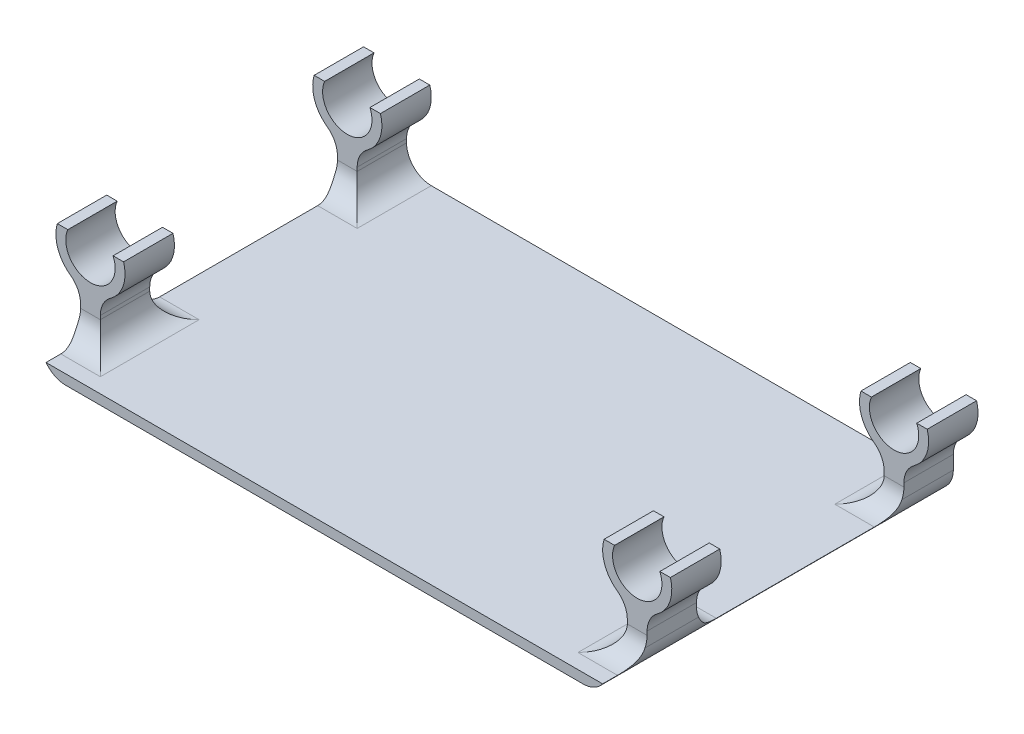
from build123d import *

# Parameters (mm, degrees)
BOSS_EXTRUDE1_DEPTH     = 70
FILLET1_R               = 5
CUT_EXTRUDE1_DEPTH      = 141.029782546
CUT_EXTRUDE1_DEPTH_BACK = 141.029782546
SKETCH2_W               = 42
SKETCH2_H               = 17.5
SKETCH2_W_2             = 8
FILLET2_R               = 5


with BuildPart() as part:
    # Sketch1 → Boss-Extrude1 (new body)
    with BuildSketch(Plane.XY):
        with BuildLine():
            Line((-114.7, 0), (0, 0))
            Line((0, 0), (0, 2))
            Line((0, 2), (0, 10.791796068))
            ThreePointArc((0, 10.791796068), (4.157630053, 14.170797072), (4.708203932, 19.5))
            Line((4.708203932, 19.5), (2.582575695, 19.5))
            ThreePointArc((2.582575695, 19.5), (-2, 12.5), (-6.582575695, 19.5))
            Line((-6.582575695, 19.5), (-8.708203932, 19.5))
            ThreePointArc((-8.708203932, 19.5), (-8.157630053, 14.170797072), (-4, 10.791796068))
            Line((-4, 10.791796068), (-4, 2))
            Line((-4, 2), (-80.775668792, 2))
            Line((-80.775668792, 2), (-81.608639994, 2))
            Line((-81.608639994, 2), (-110.7, 2))
            Line((-110.7, 2), (-110.7, 10.791796068))
            ThreePointArc((-110.7, 10.791796068), (-106.542369947, 14.170797072), (-105.991796068, 19.5))
            Line((-105.991796068, 19.5), (-108.117424305, 19.5))
            ThreePointArc((-108.117424305, 19.5), (-112.7, 12.5), (-117.282575695, 19.5))
            Line((-117.282575695, 19.5), (-119.408203932, 19.5))
            ThreePointArc((-119.408203932, 19.5), (-118.857630053, 14.170797072), (-114.7, 10.791796068))
            Line((-114.7, 10.791796068), (-114.7, 2))
            Line((-114.7, 2), (-114.7, 0))
        make_face()
    extrude(amount=BOSS_EXTRUDE1_DEPTH)

    # Fillet1
    fillet1_edges = [part.edges().sort_by_distance(p)[0] for p in [
        (0, 0, 35),
        (-114.7, 0, 35),
        (0, 10.791796068, 35),
        (-4, 10.791796068, 35),
        (-4, 2, 35),
        (-110.7, 2, 35),
        (-114.7, 10.791796068, 35),
        (-110.7, 10.791796068, 35),
    ]]
    fillet(fillet1_edges, radius=FILLET1_R)

    # Sketch2 → Cut-Extrude1 (cut, two sides: drawn at the far end of the back side and taken through both)
    with BuildSketch(Plane.ZY.offset(114.7).offset(-CUT_EXTRUDE1_DEPTH_BACK)):
        with Locations((31, 10.75)):
            Rectangle(SKETCH2_W, SKETCH2_H)
        with Locations((66, 10.75)):
            Rectangle(SKETCH2_W_2, SKETCH2_H)
    extrude(amount=CUT_EXTRUDE1_DEPTH + CUT_EXTRUDE1_DEPTH_BACK, mode=Mode.SUBTRACT)

    # Fillet2
    fillet2_edges = [part.edges().sort_by_distance(p)[0] for p in [
        (-5, 2, 10),
    ]]
    fillet(fillet2_edges, radius=FILLET2_R)
    fillet2_2_edges = [part.edges().sort_by_distance(p)[0] for p in [
        (-5, 2, 62),
    ]]
    fillet(fillet2_2_edges, radius=FILLET2_R)
    fillet2_3_edges = [part.edges().sort_by_distance(p)[0] for p in [
        (-5, 2, 52),
    ]]
    fillet(fillet2_3_edges, radius=FILLET2_R)
    fillet2_4_edges = [part.edges().sort_by_distance(p)[0] for p in [
        (-109.7, 2, 62),
    ]]
    fillet(fillet2_4_edges, radius=FILLET2_R)
    fillet2_5_edges = [part.edges().sort_by_distance(p)[0] for p in [
        (-109.7, 2, 10),
    ]]
    fillet(fillet2_5_edges, radius=FILLET2_R)
    fillet2_6_edges = [part.edges().sort_by_distance(p)[0] for p in [
        (-109.7, 2, 52),
    ]]
    fillet(fillet2_6_edges, radius=FILLET2_R)


solid = part.part
